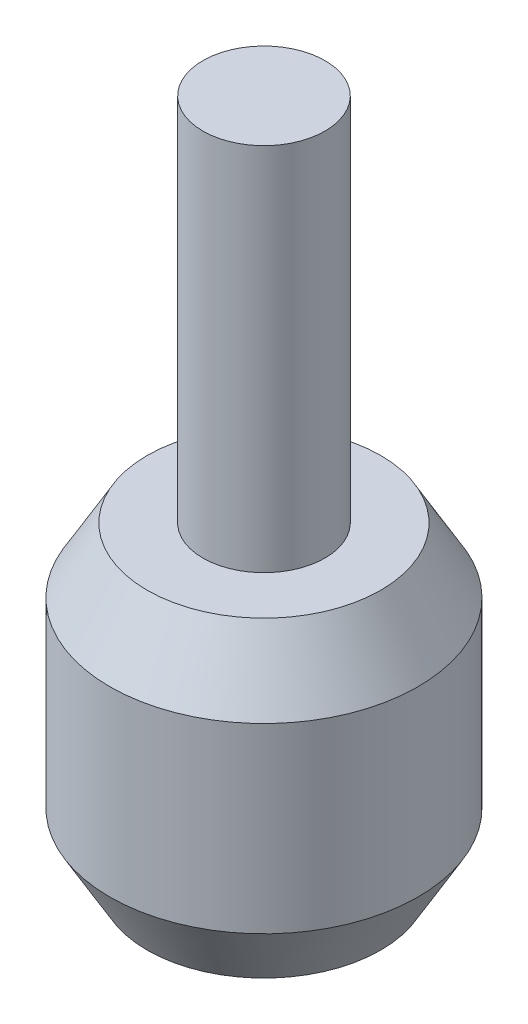
from build123d import *

# Parameters (mm, degrees)
CUT_EXTRUDE1_DEPTH = 15
SKETCH5_OUTSIDE_W  = 38.178
SKETCH5_OUTSIDE_H  = 38.178
CUT_EXTRUDE4_DEPTH = 48.97402978


# Read off the part's stored shape, not the designer's step: Save Bodies1
with BuildPart() as part:
    # Sketch3 → Revolve1 (revolve)
    with BuildSketch(Plane.XY, mode=Mode.PRIVATE) as revolve1_sk:
        Polygon((0, 0), (-4.648047108, 0), (-4.648047108, 0.405570897), (-5.210688758, 0.405570897), (-5.210688758, 0), (-7.649820617, 0), (-10.100522132, 4.244739538), (-10.100522132, 16.176790493), (-7.649820617, 20.42153003), (-4, 20.42153003), (-4, 44.648637254), (0, 44.648637254), align=None)
    revolve(revolve1_sk.sketch.rotate(Axis((0, 44.648637254, 0), (0, -1, 0)), 270), axis=Axis((0, 44.648637254, 0), (0, -1, 0)))

    # Sketch2 → Cut-Extrude1 (cut)
    with BuildSketch(Plane(origin=(0, 0, 0), x_dir=(1, 0, 0), z_dir=(0, 1, 0))):
        Polygon((3.666174209, 0), (1.833087105, 3.175), (-1.833087105, 3.175), (-3.666174209, 0), (-1.833087105, -3.175), (1.833087105, -3.175), align=None)
    extrude(amount=CUT_EXTRUDE1_DEPTH, mode=Mode.SUBTRACT)


with BuildPart() as body_2:
    # Sketch4 → Revolve2 (revolve)
    with BuildSketch(Plane.XY, mode=Mode.PRIVATE) as revolve2_sk:
        with BuildLine():
            Line((10.100522132, 16.176790493), (10.100522132, 4.244739538))
            Line((10.100522132, 4.244739538), (10.600522132, 4.244739538))
            ThreePointArc((10.600522132, 4.244739538), (12.409809018, 10.210765015), (10.600522132, 16.176790493))
            Line((10.600522132, 16.176790493), (10.100522132, 16.176790493))
        make_face()
    revolve(revolve2_sk.sketch.rotate(Axis((0, 44.648637254, 0), (0, -1, 0)), 90), axis=Axis((0, 44.648637254, 0), (0, -1, 0)))

    # Sketch5 outside → Cut-Extrude4 (cut, through all)
    with BuildSketch(Plane(origin=(0, 0, 0), x_dir=(1, 0, 0), z_dir=(0, 1, 0))):
        Rectangle(SKETCH5_OUTSIDE_W, SKETCH5_OUTSIDE_H)
        Polygon((-0.056367181, 11.203062871), (-5.650346846, 9.673953456), (-9.730320636, 5.552716025), (-11.203062871, -0.056367181), (-9.673953456, -5.650346846), (-5.552716025, -9.730320636), (0.056367181, -11.203062871), (5.650346846, -9.673953456), (9.730320636, -5.552716025), (11.203062871, 0.056367181), (9.673953456, 5.650346846), (5.552716025, 9.730320636), align=None, mode=Mode.SUBTRACT)
    extrude(amount=CUT_EXTRUDE4_DEPTH, mode=Mode.SUBTRACT)


solid = part.part
